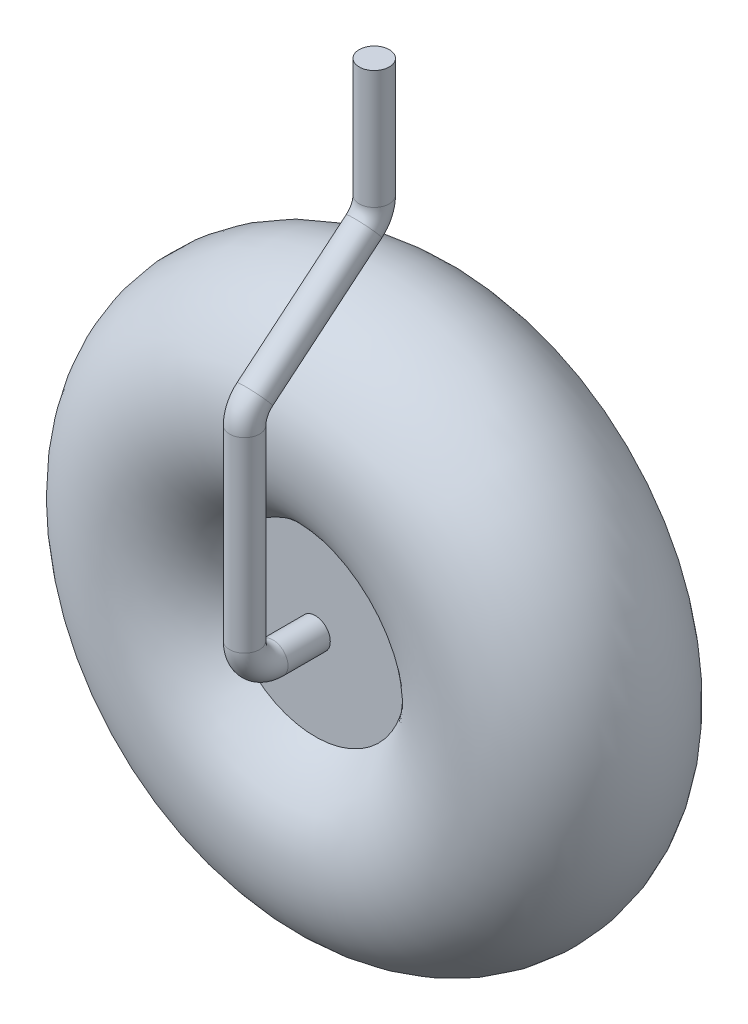
from build123d import *

# Parameters (mm, degrees)
SKETCH3_R = 1.344240024


with BuildPart() as part:
    # Sketch1 → Revolve1 (revolve)
    with BuildSketch(Plane(origin=(0, 0, 0), x_dir=(0, 0, -1), z_dir=(1, 0, 0))):
        with BuildLine():
            Line((-5.272375612, 8.036939308), (-5.272375612, 0))
            Line((-5.272375612, 0), (5.272375612, 0))
            Line((5.272375612, 0), (5.272375612, 8.036939308))
            ThreePointArc((5.272375612, 8.036939308), (0, 25.4), (-5.272375612, 8.036939308))
        make_face()
    revolve(axis=Axis((0, 0, 0), (0, 0, 1)))

    # Sweep1: sweep along a path in Sketch2
    with BuildLine(Plane(origin=(0, 0, 0), x_dir=(0, 0, -1), z_dir=(1, 0, 0))) as sweep1_path:
        Line((0, 0), (-9.050514624, 0))
        ThreePointArc((-9.050514624, 0), (-10.846565848, 0.743948776), (-11.590514624, 2.54))
        Line((-11.590514624, 2.54), (-11.590514624, 19.227855259))
        ThreePointArc((-11.590514624, 19.227855259), (-11.350486879, 20.305689952), (-10.675768463, 21.179815801))
        Line((-10.675768463, 21.179815801), (-0.914746161, 29.307100461))
        ThreePointArc((-0.914746161, 29.307100461), (-0.240027745, 30.181226311), (0, 31.259061004))
        Line((0, 31.259061004), (0, 41.860852469))
    # Sketch3 → Sweep1 (sweep)
    with BuildSketch(Plane.XY.offset(5.272375612)):
        Circle(SKETCH3_R)
    sweep(path=sweep1_path.line)


solid = part.part
